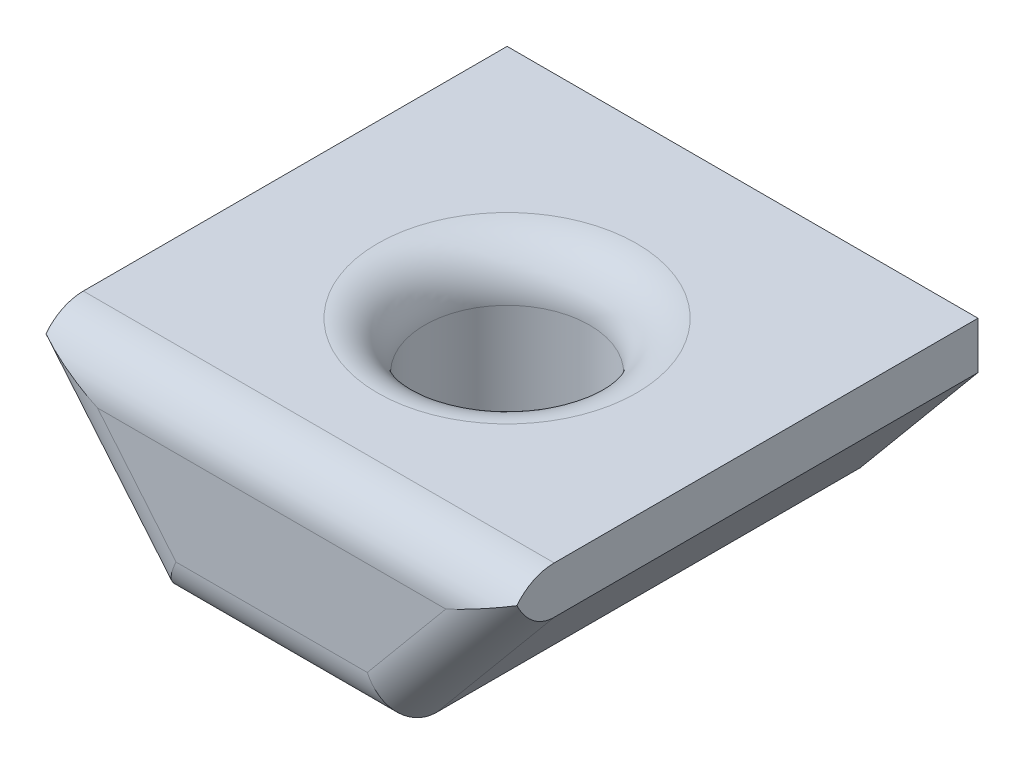
from build123d import *

# Parameters (mm, degrees)
BOSS_EXTRUDE1_DEPTH = 10
SKETCH3_R           = 1.75
CUT_EXTRUDE1_DEPTH  = 12.874342087
FILLET2_R           = 1


with BuildPart() as part:
    # Sketch1 → Boss-Extrude1 (new body)
    with BuildSketch(Plane.XY):
        Polygon((-2.5, 0), (2.5, 0), (5, 3), (5, 4), (-5, 4), (-5, 3), align=None)
    extrude(amount=BOSS_EXTRUDE1_DEPTH)

    # Sketch3 → Cut-Extrude1 (cut, through all)
    with BuildSketch(Plane(origin=(0, 4, 0), x_dir=(1, 0, 0), z_dir=(0, 1, 0))):
        with Locations(Location((0, -5, 0), (0, 0, 270))):
            Circle(SKETCH3_R)
    extrude(amount=-CUT_EXTRUDE1_DEPTH, mode=Mode.SUBTRACT)

    # Fillet2
    # the kernel refuses this fillet: 1 mm, written as the material it takes off along each edge
    with BuildSketch(Plane(origin=(-5, 0, 10), x_dir=(0, 0, -1), z_dir=(1, 0, 0))) as fillet2_piece_1:
        with BuildLine():
            CenterArc((FILLET2_R, FILLET2_R), FILLET2_R, 180, 90)
            Line((0, FILLET2_R), (0, 0))
            Line((0, 0), (FILLET2_R, 0))
        make_face()
    extrude(amount=10, mode=Mode.SUBTRACT)
    with BuildSketch(Plane(origin=(0.899539001, -1.920553199, 10), x_dir=(-0.768221279597376, 0.6401843996644797, 0), z_dir=(0.6401843996644797, 0.768221279597376, 0))) as fillet2_piece_2:
        with BuildLine():
            CenterArc((FILLET2_R, -FILLET2_R), FILLET2_R, 90, 90)
            Line((0, -FILLET2_R), (0, 0))
            Line((0, 0), (FILLET2_R, 0))
        make_face()
    extrude(amount=8.905124838, mode=Mode.SUBTRACT)
    with BuildSketch(Plane(origin=(-6.600460999, 4.920553199, 10), x_dir=(0, 0, -1), z_dir=(0.6401843996644797, -0.768221279597376, 0))) as fillet2_piece_3:
        with BuildLine():
            CenterArc((FILLET2_R, FILLET2_R), FILLET2_R, 180, 90)
            Line((0, FILLET2_R), (0, 0))
            Line((0, 0), (FILLET2_R, 0))
        make_face()
    extrude(amount=8.905124838, mode=Mode.SUBTRACT)
    with BuildSketch(Plane(origin=(7.5, 4, 10), x_dir=(0, -1, 0), z_dir=(-1, 0, 0))) as fillet2_piece_4:
        with BuildLine():
            CenterArc((FILLET2_R, -FILLET2_R), FILLET2_R, 90, 90)
            Line((0, -FILLET2_R), (0, 0))
            Line((0, 0), (FILLET2_R, 0))
        make_face()
    extrude(amount=15, mode=Mode.SUBTRACT)
    with BuildSketch(Plane(origin=(0, 4, 5), x_dir=(0, 0, 1), z_dir=(-1, 0, 0))) as fillet2_piece_5:
        with BuildLine():
            CenterArc((1.75 + FILLET2_R, -FILLET2_R), FILLET2_R, 90, 90)
            Line((1.75 + FILLET2_R, 0), (1.75, 0))
            Line((1.75, 0), (1.75, -FILLET2_R))
        make_face()
    revolve(axis=Axis((0, 4, 5), (0, 1, 0)), mode=Mode.SUBTRACT)


solid = part.part
